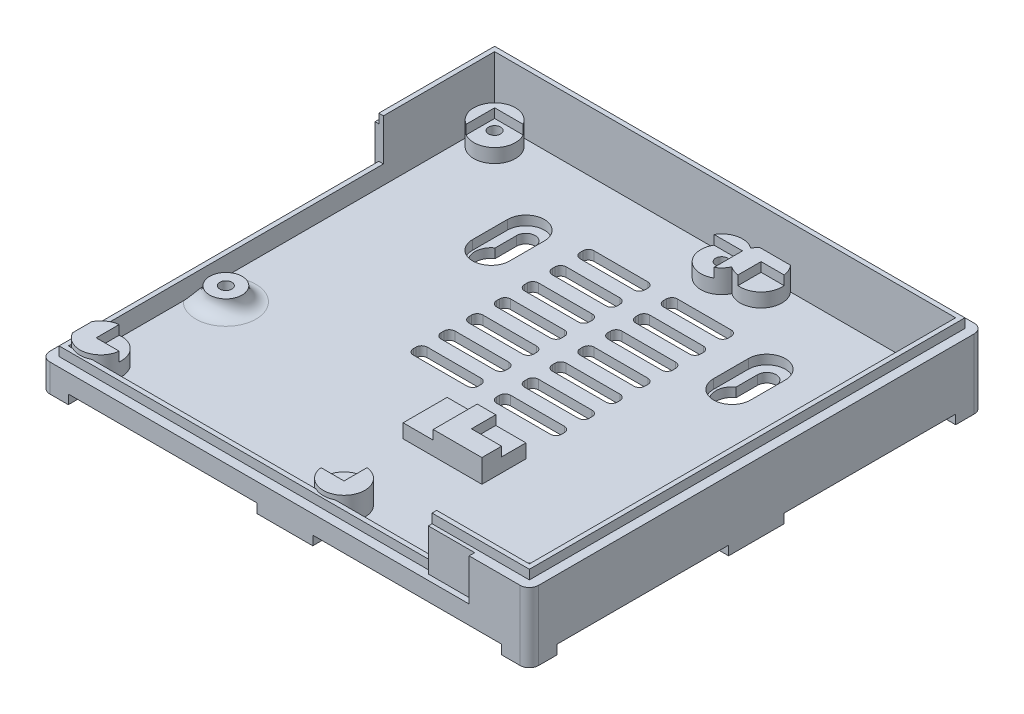
from build123d import *

# Parameters (mm, degrees)
SALIENTE_EXTRUIR1_DEPTH  = 2
SALIENTE_EXTRUIR2_START  = -4
SALIENTE_EXTRUIR2_DEPTH  = 4
CROQUIS4_R               = 6
CROQUIS4_W               = 3
CROQUIS4_H               = 12
CROQUIS4_W_2             = 12
CROQUIS4_H_2             = 3
SALIENTE_EXTRUIR3_DEPTH  = 4
CORTAR_EXTRUIR1_DEPTH    = 7
CORTAR_EXTRUIR3_DEPTH    = 2
CROQUIS7_R               = 4.5
CROQUIS7_R_2             = 3.5
CROQUIS7_R_3             = 1.3
CROQUIS7_W               = 17
CROQUIS7_H               = 9.5
SALIENTE_EXTRUIR6_DEPTH  = 3
CROQUIS8_R               = 1.3
CORTAR_EXTRUIR4_DEPTH    = 19
SALIENTE_EXTRUIR7_DEPTH  = 2
CROQUIS10_R              = 4.5
CROQUIS10_R_2            = 1.3
SALIENTE_EXTRUIR8_DEPTH  = 2
CORTAR_EXTRUIR5_DEPTH    = 4
CROQUIS12_W              = 99.5
CROQUIS12_H              = 92
SALIENTE_EXTRUIR9_DEPTH  = 2
SALIENTE_EXTRUIR11_DEPTH = 9
SALIENTE_EXTRUIR12_DEPTH = 2
CROQUIS16_W              = 1.2
CROQUIS16_H              = 5
CROQUIS16_W_2            = 10
CROQUIS16_H_2            = 1.2
CORTAR_EXTRUIR6_DEPTH    = 9
SALIENTE_EXTRUIR13_DEPTH = 2
CORTAR_EXTRUIR7_START    = -10
CROQUIS18_R              = 1.3
CORTAR_EXTRUIR7_DEPTH    = 10
CROQUIS19_R              = 2
CORTAR_EXTRUIR8_DEPTH    = 1.5
REDONDEO1_R              = 3


with BuildPart() as part:
    # Croquis2 → Saliente-Extruir1 (new body)
    with BuildSketch(Plane(origin=(0, 0, 0), x_dir=(1, 0, 0), z_dir=(0, 1, 0))):
        with BuildLine():
            Line((-30.25, 36.75), (71.25, 36.75))
            ThreePointArc((71.25, 36.75), (72.664213562, 36.164213562), (73.25, 34.75))
            Line((73.25, 34.75), (73.25, -59.25))
            ThreePointArc((73.25, -59.25), (72.664213562, -60.664213562), (71.25, -61.25))
            Line((71.25, -61.25), (-30.25, -61.25))
            ThreePointArc((-30.25, -61.25), (-31.664213562, -60.664213562), (-32.25, -59.25))
            Line((-32.25, -59.25), (-32.25, 34.75))
            ThreePointArc((-32.25, 34.75), (-31.664213562, 36.164213562), (-30.25, 36.75))
        make_face()
    extrude(amount=SALIENTE_EXTRUIR1_DEPTH)

    # Croquis3 → Saliente-Extruir2 (add)
    with BuildSketch(Plane(origin=(0, 2, 0), x_dir=(1, 0, 0), z_dir=(0, 1, 0)).offset(SALIENTE_EXTRUIR2_START)):
        with BuildLine():
            Line((-26.25, -58.25), (-26.25, -61.25))
            Line((-26.25, -61.25), (-30.25, -61.25))
            ThreePointArc((-30.25, -61.25), (-31.664213562, -60.664213562), (-32.25, -59.25))
            Line((-32.25, -59.25), (-32.25, -55.25))
            Line((-32.25, -55.25), (-29.25, -55.25))
            ThreePointArc((-29.25, -55.25), (-28.371320344, -57.371320344), (-26.25, -58.25))
        make_face()
        with BuildLine():
            Line((-32.25, 30.75), (-32.25, 34.75))
            ThreePointArc((-32.25, 34.75), (-31.664213562, 36.164213562), (-30.25, 36.75))
            Line((-30.25, 36.75), (-26.25, 36.75))
            Line((-26.25, 36.75), (-26.25, 33.75))
            ThreePointArc((-26.25, 33.75), (-28.371320344, 32.871320344), (-29.25, 30.75))
            Line((-29.25, 30.75), (-32.25, 30.75))
        make_face()
        with BuildLine():
            Line((73.25, -55.25), (73.25, -59.25))
            ThreePointArc((73.25, -59.25), (72.664213562, -60.664213562), (71.25, -61.25))
            Line((71.25, -61.25), (67.25, -61.25))
            Line((67.25, -61.25), (67.25, -58.25))
            ThreePointArc((67.25, -58.25), (69.371320344, -57.371320344), (70.25, -55.25))
            Line((70.25, -55.25), (73.25, -55.25))
        make_face()
        with BuildLine():
            Line((70.25, 30.75), (73.25, 30.75))
            Line((73.25, 30.75), (73.25, 34.75))
            ThreePointArc((73.25, 34.75), (72.664213562, 36.164213562), (71.25, 36.75))
            Line((71.25, 36.75), (67.25, 36.75))
            Line((67.25, 36.75), (67.25, 33.75))
            ThreePointArc((67.25, 33.75), (69.371320344, 32.871320344), (70.25, 30.75))
        make_face()
    extrude(amount=SALIENTE_EXTRUIR2_DEPTH)

    # Croquis4 → Saliente-Extruir3 (add)
    with BuildSketch(Plane(origin=(0, 2, 0), x_dir=(1, 0, 0), z_dir=(0, 1, 0))):
        with Locations(Location((20.5, -38.25, 0), (0, 0, 270))):
            Circle(CROQUIS4_R)
        with Locations((-30.75, -12.25)):
            Rectangle(CROQUIS4_W, CROQUIS4_H)
        with Locations((71.75, -12.25)):
            Rectangle(CROQUIS4_W, CROQUIS4_H)
        with Locations((20.5, -59.75)):
            Rectangle(CROQUIS4_W_2, CROQUIS4_H_2)
        with Locations((20.5, 35.25)):
            Rectangle(CROQUIS4_W_2, CROQUIS4_H_2)
        with BuildLine():
            Line((44.5, 22.75), (48.5, 22.75))
            ThreePointArc((48.5, 22.75), (52.035533906, 21.285533906), (53.5, 17.75))
            Line((53.5, 17.75), (53.5, 8.75))
            ThreePointArc((53.5, 8.75), (52.035533906, 5.214466094), (48.5, 3.75))
            Line((48.5, 3.75), (44.5, 3.75))
            ThreePointArc((44.5, 3.75), (40.964466094, 5.214466094), (39.5, 8.75))
            Line((39.5, 8.75), (39.5, 17.75))
            ThreePointArc((39.5, 17.75), (40.964466094, 21.285533906), (44.5, 22.75))
        make_face()
        with BuildLine():
            Line((-3.5, 3.75), (-7.5, 3.75))
            ThreePointArc((-7.5, 3.75), (-11.035533906, 5.214466094), (-12.5, 8.75))
            Line((-12.5, 8.75), (-12.5, 17.75))
            ThreePointArc((-12.5, 17.75), (-11.035533906, 21.285533906), (-7.5, 22.75))
            Line((-7.5, 22.75), (-3.5, 22.75))
            ThreePointArc((-3.5, 22.75), (0.035533906, 21.285533906), (1.5, 17.75))
            Line((1.5, 17.75), (1.5, 8.75))
            ThreePointArc((1.5, 8.75), (0.035533906, 5.214466094), (-3.5, 3.75))
        make_face()
    extrude(amount=-SALIENTE_EXTRUIR3_DEPTH)

    # Croquis5 → Cortar-Extruir1 (cut)
    with BuildSketch(Plane(origin=(0, -2, 0), x_dir=(-1, 0, 0), z_dir=(0, -1, 0))):
        with BuildLine():
            Line((3.5, 16.75), (3.5, 12.122281323))
            ThreePointArc((3.5, 12.122281323), (5.5, 5.75), (7.5, 12.122281323))
            Line((7.5, 12.122281323), (7.5, 16.75))
            ThreePointArc((7.5, 16.75), (5.5, 18.75), (3.5, 16.75))
        make_face()
        with BuildLine():
            Line((-44.5, 16.75), (-44.5, 12.122281323))
            ThreePointArc((-44.5, 12.122281323), (-46.5, 5.75), (-48.5, 12.122281323))
            Line((-48.5, 12.122281323), (-48.5, 16.75))
            ThreePointArc((-48.5, 16.75), (-46.5, 18.75), (-44.5, 16.75))
        make_face()
    extrude(amount=-CORTAR_EXTRUIR1_DEPTH, mode=Mode.SUBTRACT)

    # Croquis6 → Cortar-Extruir3 (cut)
    with BuildSketch(Plane(origin=(0, 2, 0), x_dir=(1, 0, 0), z_dir=(0, 1, 0))):
        with BuildLine():
            Line((-9.5, 9.25), (-9.5, 16.75))
            ThreePointArc((-9.5, 16.75), (-5.5, 20.75), (-1.5, 16.75))
            Line((-1.5, 16.75), (-1.5, 9.25))
            ThreePointArc((-1.5, 9.25), (-5.5, 5.25), (-9.5, 9.25))
        make_face()
        with BuildLine():
            Line((42.5, 9.25), (42.5, 16.75))
            ThreePointArc((42.5, 16.75), (46.5, 20.75), (50.5, 16.75))
            Line((50.5, 16.75), (50.5, 9.25))
            ThreePointArc((50.5, 9.25), (46.5, 5.25), (42.5, 9.25))
        make_face()
    extrude(amount=-CORTAR_EXTRUIR3_DEPTH, mode=Mode.SUBTRACT)

    # Croquis7 → Saliente-Extruir6 (add)
    # profile 1 of 9: a face of its own
    with BuildSketch(Plane(origin=(0, 2, 0), x_dir=(-1, 0, 0), z_dir=(0, -1, 0))):
        with Locations(Location((24.5, 29, 0), (0, 0, 90))):
            Circle(CROQUIS7_R)
    # profile 2 of 9: a face of its own
    with BuildSketch(Plane(origin=(0, 2, 0), x_dir=(-1, 0, 0), z_dir=(0, -1, 0))):
        with Locations(Location((-65.25, -53.25, 0), (0, 0, 90))):
            Circle(CROQUIS7_R)
    # profile 3 of 9: a face of its own
    with BuildSketch(Plane(origin=(0, 2, 0), x_dir=(-1, 0, 0), z_dir=(0, -1, 0))):
        with Locations(Location((-67.25, 30.75, 0), (0, 0, 90))):
            Circle(CROQUIS7_R)
    # profile 4 of 9: a face of its own
    with BuildSketch(Plane(origin=(0, 2, 0), x_dir=(-1, 0, 0), z_dir=(0, -1, 0))):
        with Locations(Location((-67.25, -30.75, 0), (0, 0, 90))):
            Circle(CROQUIS7_R)
    # profile 5 of 9: a face of its own
    with BuildSketch(Plane(origin=(0, 2, 0), x_dir=(-1, 0, 0), z_dir=(0, -1, 0))):
        with Locations(Location((-26.25, -54.25, 0), (0, 0, 90))):
            Circle(CROQUIS7_R)
    # profile 6 of 9: a face of its own
    with BuildSketch(Plane(origin=(0, 2, 0), x_dir=(-1, 0, 0), z_dir=(0, -1, 0))):
        with Locations(Location((26.25, -54.25, 0), (0, 0, 90))):
            Circle(CROQUIS7_R)
    # profile 7 of 9: a face of its own
    with BuildSketch(Plane(origin=(0, 2, 0), x_dir=(-1, 0, 0), z_dir=(0, -1, 0))):
        with Locations(Location((24.5, -29, 0), (0, 0, 90))):
            Circle(CROQUIS7_R_2)
        with Locations(Location((24.5, -29, 0), (0, 0, 90))):
            Circle(CROQUIS7_R_3, mode=Mode.SUBTRACT)
    # profile 8 of 9: a face of its own
    with BuildSketch(Plane(origin=(0, 2, 0), x_dir=(-1, 0, 0), z_dir=(0, -1, 0))):
        with Locations((-28.75, -30.75)):
            Rectangle(CROQUIS7_W, CROQUIS7_H)
    # profile 9 of 9: a face of its own
    with BuildSketch(Plane(origin=(0, 2, 0), x_dir=(-1, 0, 0), z_dir=(0, -1, 0))):
        with BuildLine():
            ThreePointArc((-28.588975213, 27.121095609), (-20.144013958, 27.870670285), (-27.161024787, 32.628904391))
            ThreePointArc((-27.161024787, 32.628904391), (-35.605986042, 31.879329715), (-28.588975213, 27.121095609))
        make_face()
    extrude(amount=-SALIENTE_EXTRUIR6_DEPTH)

    # Croquis8 → Cortar-Extruir4 (cut)
    with BuildSketch(Plane.XZ):
        with Locations(Location((-24.5, -29, 0), (0, 0, 270))):
            Circle(CROQUIS8_R)
        with Locations(Location((24.5, -29, 0), (0, 0, 270))):
            Circle(CROQUIS8_R)
        with Locations(Location((65.25, 53.25, 0), (0, 0, 270))):
            Circle(CROQUIS8_R)
    extrude(amount=-CORTAR_EXTRUIR4_DEPTH, mode=Mode.SUBTRACT)

    # Croquis9 → Saliente-Extruir7 (add)
    with BuildSketch(Plane(origin=(0, 5, 0), x_dir=(1, 0, 0), z_dir=(0, 1, 0))):
        Polygon((37.25, -35.5), (37.25, -31.25), (30.75, -31.25), (30.75, -26), (26.75, -26), (26.75, -35.5), align=None)
        with BuildLine():
            Line((-26.75, -49.777864045), (-26.75, -54.75))
            Line((-26.75, -54.75), (-21.777864045, -54.75))
            ThreePointArc((-21.777864045, -54.75), (-29.431980515, -57.431980515), (-26.75, -49.777864045))
        make_face()
        with BuildLine():
            Line((21.777864045, -54.75), (26.75, -54.75))
            Line((26.75, -54.75), (26.75, -49.777864045))
            ThreePointArc((26.75, -49.777864045), (29.431980515, -57.431980515), (21.777864045, -54.75))
        make_face()
        with BuildLine():
            Line((62.777864045, -31.25), (67.75, -31.25))
            Line((67.75, -31.25), (67.75, -26.277864045))
            ThreePointArc((67.75, -26.277864045), (70.431980515, -33.931980515), (62.777864045, -31.25))
        make_face()
        with BuildLine():
            Line((62.777864045, 31.25), (67.75, 31.25))
            Line((67.75, 31.25), (67.75, 26.277864045))
            ThreePointArc((67.75, 26.277864045), (70.431980515, 33.931980515), (62.777864045, 31.25))
        make_face()
        with BuildLine():
            Line((20.602885683, 31.25), (26.75, 31.25))
            Line((26.75, 31.25), (26.75, 25.102885683))
            ThreePointArc((26.75, 25.102885683), (27.826250819, 25.969149379), (28.588975213, 27.121095609))
            ThreePointArc((28.588975213, 27.121095609), (29.614219057, 26.557838182), (30.75, 26.277864045))
            Line((30.75, 26.277864045), (30.75, 31.25))
            Line((30.75, 31.25), (35.722135955, 31.25))
            ThreePointArc((35.722135955, 31.25), (31.965574852, 35.192741567), (27.161024787, 32.628904391))
            ThreePointArc((27.161024787, 32.628904391), (23.57408226, 33.403711655), (20.602885683, 31.25))
        make_face()
        with BuildLine():
            Line((-26.75, 25.102885683), (-26.75, 31.25))
            Line((-26.75, 31.25), (-20.602885683, 31.25))
            ThreePointArc((-20.602885683, 31.25), (-27.681980515, 32.181980515), (-26.75, 25.102885683))
        make_face()
    extrude(amount=SALIENTE_EXTRUIR7_DEPTH)

    # Croquis10 → Saliente-Extruir8 (add)
    with BuildSketch(Plane(origin=(0, 5, 0), x_dir=(1, 0, 0), z_dir=(0, 1, 0))):
        with Locations(Location((65.25, -53.25, 0), (0, 0, 270))):
            Circle(CROQUIS10_R)
        with Locations(Location((65.25, -53.25, 0), (0, 0, 90))):
            Circle(CROQUIS10_R_2, mode=Mode.SUBTRACT)
    extrude(amount=SALIENTE_EXTRUIR8_DEPTH)

    # Croquis11 → Cortar-Extruir5 (cut)
    with BuildSketch(Plane(origin=(0, 2, 0), x_dir=(1, 0, 0), z_dir=(0, 1, 0))):
        with BuildLine():
            Line((35.3, 17.25), (23.7, 17.25))
            ThreePointArc((23.7, 17.25), (22.851471863, 17.601471863), (22.5, 18.45))
            Line((22.5, 18.45), (22.5, 19.05))
            ThreePointArc((22.5, 19.05), (22.851471863, 19.898528137), (23.7, 20.25))
            Line((23.7, 20.25), (35.3, 20.25))
            ThreePointArc((35.3, 20.25), (36.148528137, 19.898528137), (36.5, 19.05))
            Line((36.5, 19.05), (36.5, 18.45))
            ThreePointArc((36.5, 18.45), (36.148528137, 17.601471863), (35.3, 17.25))
        make_face()
        with BuildLine():
            Line((5.7, 20.25), (17.3, 20.25))
            ThreePointArc((17.3, 20.25), (18.148528137, 19.898528137), (18.5, 19.05))
            Line((18.5, 19.05), (18.5, 18.45))
            ThreePointArc((18.5, 18.45), (18.148528137, 17.601471863), (17.3, 17.25))
            Line((17.3, 17.25), (5.7, 17.25))
            ThreePointArc((5.7, 17.25), (4.851471863, 17.601471863), (4.5, 18.45))
            Line((4.5, 18.45), (4.5, 19.05))
            ThreePointArc((4.5, 19.05), (4.851471863, 19.898528137), (5.7, 20.25))
        make_face()
        with BuildLine():
            Line((4.5, 13.05), (4.5, 12.45))
            ThreePointArc((4.5, 12.45), (4.851471863, 11.601471863), (5.7, 11.25))
            Line((5.7, 11.25), (17.3, 11.25))
            ThreePointArc((17.3, 11.25), (18.148528137, 11.601471863), (18.5, 12.45))
            Line((18.5, 12.45), (18.5, 13.05))
            ThreePointArc((18.5, 13.05), (18.148528137, 13.898528137), (17.3, 14.25))
            Line((17.3, 14.25), (5.7, 14.25))
            ThreePointArc((5.7, 14.25), (4.851471863, 13.898528137), (4.5, 13.05))
        make_face()
        with BuildLine():
            Line((35.3, 11.25), (23.7, 11.25))
            ThreePointArc((23.7, 11.25), (22.851471863, 11.601471863), (22.5, 12.45))
            Line((22.5, 12.45), (22.5, 13.05))
            ThreePointArc((22.5, 13.05), (22.851471863, 13.898528137), (23.7, 14.25))
            Line((23.7, 14.25), (35.3, 14.25))
            ThreePointArc((35.3, 14.25), (36.148528137, 13.898528137), (36.5, 13.05))
            Line((36.5, 13.05), (36.5, 12.45))
            ThreePointArc((36.5, 12.45), (36.148528137, 11.601471863), (35.3, 11.25))
        make_face()
        with BuildLine():
            Line((4.5, 7.05), (4.5, 6.45))
            ThreePointArc((4.5, 6.45), (4.851471863, 5.601471863), (5.7, 5.25))
            Line((5.7, 5.25), (17.3, 5.25))
            ThreePointArc((17.3, 5.25), (18.148528137, 5.601471863), (18.5, 6.45))
            Line((18.5, 6.45), (18.5, 7.05))
            ThreePointArc((18.5, 7.05), (18.148528137, 7.898528137), (17.3, 8.25))
            Line((17.3, 8.25), (5.7, 8.25))
            ThreePointArc((5.7, 8.25), (4.851471863, 7.898528137), (4.5, 7.05))
        make_face()
        with BuildLine():
            Line((35.3, 5.25), (23.7, 5.25))
            ThreePointArc((23.7, 5.25), (22.851471863, 5.601471863), (22.5, 6.45))
            Line((22.5, 6.45), (22.5, 7.05))
            ThreePointArc((22.5, 7.05), (22.851471863, 7.898528137), (23.7, 8.25))
            Line((23.7, 8.25), (35.3, 8.25))
            ThreePointArc((35.3, 8.25), (36.148528137, 7.898528137), (36.5, 7.05))
            Line((36.5, 7.05), (36.5, 6.45))
            ThreePointArc((36.5, 6.45), (36.148528137, 5.601471863), (35.3, 5.25))
        make_face()
        with BuildLine():
            Line((4.5, 1.05), (4.5, 0.45))
            ThreePointArc((4.5, 0.45), (4.851471863, -0.398528137), (5.7, -0.75))
            Line((5.7, -0.75), (17.3, -0.75))
            ThreePointArc((17.3, -0.75), (18.148528137, -0.398528137), (18.5, 0.45))
            Line((18.5, 0.45), (18.5, 1.05))
            ThreePointArc((18.5, 1.05), (18.148528137, 1.898528137), (17.3, 2.25))
            Line((17.3, 2.25), (5.7, 2.25))
            ThreePointArc((5.7, 2.25), (4.851471863, 1.898528137), (4.5, 1.05))
        make_face()
        with BuildLine():
            Line((35.3, -0.75), (23.7, -0.75))
            ThreePointArc((23.7, -0.75), (22.851471863, -0.398528137), (22.5, 0.45))
            Line((22.5, 0.45), (22.5, 1.05))
            ThreePointArc((22.5, 1.05), (22.851471863, 1.898528137), (23.7, 2.25))
            Line((23.7, 2.25), (35.3, 2.25))
            ThreePointArc((35.3, 2.25), (36.148528137, 1.898528137), (36.5, 1.05))
            Line((36.5, 1.05), (36.5, 0.45))
            ThreePointArc((36.5, 0.45), (36.148528137, -0.398528137), (35.3, -0.75))
        make_face()
        with BuildLine():
            Line((4.5, -4.95), (4.5, -5.55))
            ThreePointArc((4.5, -5.55), (4.851471863, -6.398528137), (5.7, -6.75))
            Line((5.7, -6.75), (17.3, -6.75))
            ThreePointArc((17.3, -6.75), (18.148528137, -6.398528137), (18.5, -5.55))
            Line((18.5, -5.55), (18.5, -4.95))
            ThreePointArc((18.5, -4.95), (18.148528137, -4.101471863), (17.3, -3.75))
            Line((17.3, -3.75), (5.7, -3.75))
            ThreePointArc((5.7, -3.75), (4.851471863, -4.101471863), (4.5, -4.95))
        make_face()
        with BuildLine():
            Line((35.3, -6.75), (23.7, -6.75))
            ThreePointArc((23.7, -6.75), (22.851471863, -6.398528137), (22.5, -5.55))
            Line((22.5, -5.55), (22.5, -4.95))
            ThreePointArc((22.5, -4.95), (22.851471863, -4.101471863), (23.7, -3.75))
            Line((23.7, -3.75), (35.3, -3.75))
            ThreePointArc((35.3, -3.75), (36.148528137, -4.101471863), (36.5, -4.95))
            Line((36.5, -4.95), (36.5, -5.55))
            ThreePointArc((36.5, -5.55), (36.148528137, -6.398528137), (35.3, -6.75))
        make_face()
        with BuildLine():
            Line((4.5, -10.95), (4.5, -11.55))
            ThreePointArc((4.5, -11.55), (4.851471863, -12.398528137), (5.7, -12.75))
            Line((5.7, -12.75), (17.3, -12.75))
            ThreePointArc((17.3, -12.75), (18.148528137, -12.398528137), (18.5, -11.55))
            Line((18.5, -11.55), (18.5, -10.95))
            ThreePointArc((18.5, -10.95), (18.148528137, -10.101471863), (17.3, -9.75))
            Line((17.3, -9.75), (5.7, -9.75))
            ThreePointArc((5.7, -9.75), (4.851471863, -10.101471863), (4.5, -10.95))
        make_face()
        with BuildLine():
            Line((35.3, -12.75), (23.7, -12.75))
            ThreePointArc((23.7, -12.75), (22.851471863, -12.398528137), (22.5, -11.55))
            Line((22.5, -11.55), (22.5, -10.95))
            ThreePointArc((22.5, -10.95), (22.851471863, -10.101471863), (23.7, -9.75))
            Line((23.7, -9.75), (35.3, -9.75))
            ThreePointArc((35.3, -9.75), (36.148528137, -10.101471863), (36.5, -10.95))
            Line((36.5, -10.95), (36.5, -11.55))
            ThreePointArc((36.5, -11.55), (36.148528137, -12.398528137), (35.3, -12.75))
        make_face()
        with BuildLine():
            Line((4.5, -16.95), (4.5, -17.55))
            ThreePointArc((4.5, -17.55), (4.851471863, -18.398528137), (5.7, -18.75))
            Line((5.7, -18.75), (17.3, -18.75))
            ThreePointArc((17.3, -18.75), (18.148528137, -18.398528137), (18.5, -17.55))
            Line((18.5, -17.55), (18.5, -16.95))
            ThreePointArc((18.5, -16.95), (18.148528137, -16.101471863), (17.3, -15.75))
            Line((17.3, -15.75), (5.7, -15.75))
            ThreePointArc((5.7, -15.75), (4.851471863, -16.101471863), (4.5, -16.95))
        make_face()
        with BuildLine():
            Line((35.3, -18.75), (23.7, -18.75))
            ThreePointArc((23.7, -18.75), (22.851471863, -18.398528137), (22.5, -17.55))
            Line((22.5, -17.55), (22.5, -16.95))
            ThreePointArc((22.5, -16.95), (22.851471863, -16.101471863), (23.7, -15.75))
            Line((23.7, -15.75), (35.3, -15.75))
            ThreePointArc((35.3, -15.75), (36.148528137, -16.101471863), (36.5, -16.95))
            Line((36.5, -16.95), (36.5, -17.55))
            ThreePointArc((36.5, -17.55), (36.148528137, -18.398528137), (35.3, -18.75))
        make_face()
    extrude(amount=-CORTAR_EXTRUIR5_DEPTH, mode=Mode.SUBTRACT)

    # Croquis12 → Saliente-Extruir9 (add)
    with BuildSketch(Plane(origin=(0, 2, 0), x_dir=(1, 0, 0), z_dir=(0, 1, 0))):
        with BuildLine():
            Line((71.25, 36.75), (-30.25, 36.75))
            ThreePointArc((-30.25, 36.75), (-31.664213562, 36.164213562), (-32.25, 34.75))
            Line((-32.25, 34.75), (-32.25, -59.25))
            ThreePointArc((-32.25, -59.25), (-31.664213562, -60.664213562), (-30.25, -61.25))
            Line((-30.25, -61.25), (71.25, -61.25))
            ThreePointArc((71.25, -61.25), (72.664213562, -60.664213562), (73.25, -59.25))
            Line((73.25, -59.25), (73.25, 34.75))
            ThreePointArc((73.25, 34.75), (72.664213562, 36.164213562), (71.25, 36.75))
        make_face()
        with Locations((20.5, -12.25)):
            Rectangle(CROQUIS12_W, CROQUIS12_H, mode=Mode.SUBTRACT)
    extrude(amount=SALIENTE_EXTRUIR9_DEPTH)

    # Croquis13 → Saliente-Extruir11 (add)
    with BuildSketch(Plane(origin=(0, 4, 0), x_dir=(1, 0, 0), z_dir=(0, 1, 0))):
        with BuildLine():
            Line((-32.25, 9.75), (-29.25, 9.75))
            Line((-29.25, 9.75), (-29.25, 33.75))
            Line((-29.25, 33.75), (70.25, 33.75))
            Line((70.25, 33.75), (70.25, -5.25))
            Line((70.25, -5.25), (70.25, -58.25))
            Line((70.25, -58.25), (50.25, -58.25))
            Line((50.25, -58.25), (50.25, -61.25))
            Line((50.25, -61.25), (71.25, -61.25))
            ThreePointArc((71.25, -61.25), (72.664213562, -60.664213562), (73.25, -59.25))
            Line((73.25, -59.25), (73.25, -5.25))
            Line((73.25, -5.25), (73.25, 34.75))
            ThreePointArc((73.25, 34.75), (72.664213562, 36.164213562), (71.25, 36.75))
            Line((71.25, 36.75), (-30.25, 36.75))
            ThreePointArc((-30.25, 36.75), (-31.664213562, 36.164213562), (-32.25, 34.75))
            Line((-32.25, 34.75), (-32.25, 9.75))
        make_face()
    extrude(amount=SALIENTE_EXTRUIR11_DEPTH)

    # Croquis14 → Saliente-Extruir12 (add)
    with BuildSketch(Plane(origin=(0, 4, 0), x_dir=(1, 0, 0), z_dir=(0, 1, 0))):
        Polygon((-29.25, 9.75), (-29.25, -58.25), (50.25, -58.25), (50.25, -59.25), (-30.25, -59.25), (-30.25, 9.75), align=None)
    extrude(amount=SALIENTE_EXTRUIR12_DEPTH)

    # Croquis16 → Cortar-Extruir6 (cut)
    with BuildSketch(Plane(origin=(0, 13, 0), x_dir=(1, 0, 0), z_dir=(0, 1, 0))):
        with Locations((-31.65, 12.25)):
            Rectangle(CROQUIS16_W, CROQUIS16_H)
        Polygon((-30.25, -59.25), (-30.25, -49.782725852), (-31.05, -51.385365152), (-31.05, -58.21566122), align=None)
        with Locations((55.25, -60.65)):
            Rectangle(CROQUIS16_W_2, CROQUIS16_H_2)
    extrude(amount=-CORTAR_EXTRUIR6_DEPTH, mode=Mode.SUBTRACT)

    # Croquis17 → Saliente-Extruir13 (add)
    with BuildSketch(Plane(origin=(0, 13, 0), x_dir=(1, 0, 0), z_dir=(0, 1, 0))):
        Polygon((70.25, -58.25), (50.25, -58.25), (50.25, -59.25), (71.25, -59.25), (71.25, 34.75), (-30.25, 34.75), (-30.25, 9.75), (-29.25, 9.75), (-29.25, 33.75), (70.25, 33.75), align=None)
    extrude(amount=SALIENTE_EXTRUIR13_DEPTH)

    # Croquis18 → Cortar-Extruir7 (cut)
    with BuildSketch(Plane(origin=(0, 5, 0), x_dir=(1, 0, 0), z_dir=(0, 1, 0)).offset(CORTAR_EXTRUIR7_START)):
        with Locations(Location((-24.5, -29, 0), (0, 0, 90))):
            Circle(CROQUIS18_R)
    extrude(amount=CORTAR_EXTRUIR7_DEPTH, mode=Mode.SUBTRACT)

    # Croquis19 → Cortar-Extruir8 (cut)
    with BuildSketch(Plane.XZ):
        with Locations(Location((-24.5, -29, 0), (0, 0, 270))):
            Circle(CROQUIS19_R)
        with Locations(Location((24.5, -29, 0), (0, 0, 270))):
            Circle(CROQUIS19_R)
        with Locations(Location((-24.5, 29, 0), (0, 0, 270))):
            Circle(CROQUIS19_R)
        with Locations(Location((65.25, 53.25, 0), (0, 0, 270))):
            Circle(CROQUIS19_R)
    extrude(amount=-CORTAR_EXTRUIR8_DEPTH, mode=Mode.SUBTRACT)

    # Redondeo1
    # the kernel refuses this fillet: 3 mm, written as the material it adds along each edge
    with BuildSketch(Plane(origin=(-24.5, 2, 29), x_dir=(0, 0, -1), z_dir=(-1, 0, 0))) as redondeo1_piece_1:
        with BuildLine():
            CenterArc((3.5 + REDONDEO1_R, -REDONDEO1_R), REDONDEO1_R, 90, 90)
            Line((3.5, -REDONDEO1_R), (3.5, 0))
            Line((3.5, 0), (3.5 + REDONDEO1_R, 0))
        make_face()
    revolve(axis=Axis((-24.5, 2, 29), (0, -1, 0)))


solid = part.part
